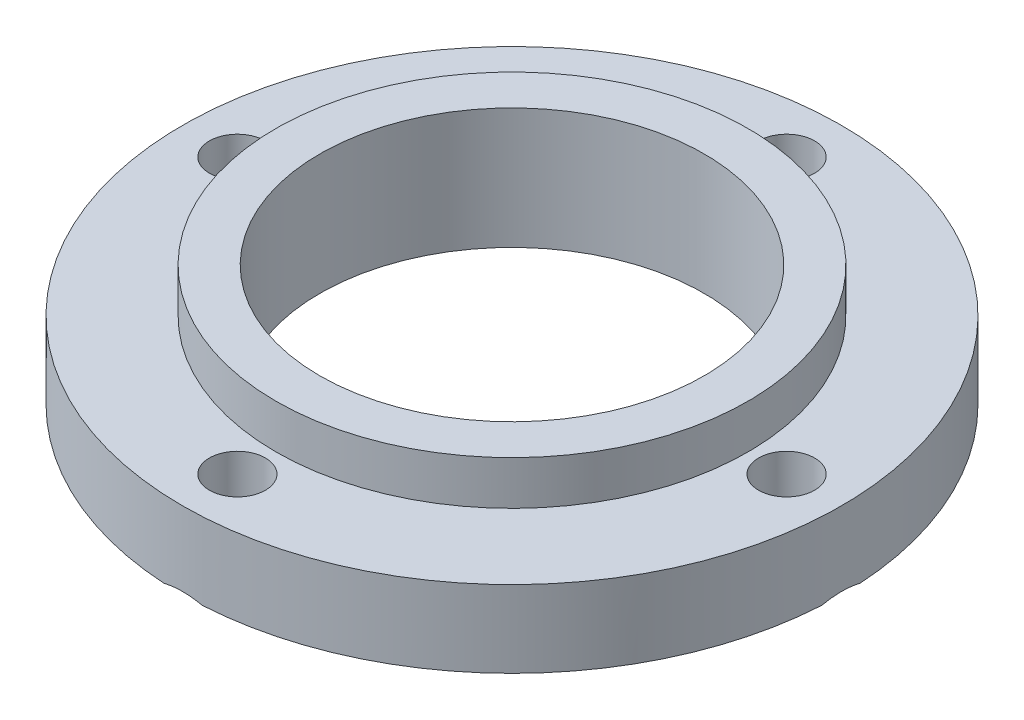
from build123d import *

# Parameters (mm, degrees)
SKETCH1_R                    = 30
SKETCH1_R_2                  = 17.5
BOSS_EXTRUDE1_DEPTH          = 7
SKETCH2_R                    = 21.5
SKETCH2_R_2                  = 17.5
BOSS_EXTRUDE2_DEPTH          = 4
SKETCH4_R                    = 2.55
CUT_EXTRUDE1_DEPTH           = 44.829214002
CHAMFER1_SIZE                = 2.7
CIRPATTERN1_COUNT            = 4
CHAMFER1_OF_CIRPATTERN1_SIZE = 2.7


with BuildPart() as part:
    # Sketch1 → Boss-Extrude1 (new body)
    with BuildSketch(Plane(origin=(0, 0, 0), x_dir=(1, 0, 0), z_dir=(0, 1, 0))):
        with Locations(Location((0, 0, 0), (0, 0, 270))):
            Circle(SKETCH1_R)
        with Locations(Location((0, 0, 0), (0, 0, 270))):
            Circle(SKETCH1_R_2, mode=Mode.SUBTRACT)
    extrude(amount=BOSS_EXTRUDE1_DEPTH)

    # Sketch2 → Boss-Extrude2 (add)
    with BuildSketch(Plane(origin=(0, 7, 0), x_dir=(1, 0, 0), z_dir=(0, 1, 0))):
        with Locations(Location((0, 0, 0), (0, 0, 270))):
            Circle(SKETCH2_R)
        with Locations(Location((0, 0, 0), (0, 0, 270))):
            Circle(SKETCH2_R_2, mode=Mode.SUBTRACT)
    extrude(amount=BOSS_EXTRUDE2_DEPTH)

    # Sketch4 → Cut-Extrude1 (cut, through all)
    with BuildSketch(Plane.XZ):
        with Locations(Location((25, 0, 0), (0, 0, 270))):
            Circle(SKETCH4_R)
    cut_extrude1 = extrude(amount=-CUT_EXTRUDE1_DEPTH, mode=Mode.SUBTRACT)

    # Chamfer1
    # the kernel refuses this chamfer: 2.7 mm, written as the material it takes off along each edge
    with BuildSketch(Plane(origin=(25, 0, 0), x_dir=(0, 0, -1), z_dir=(-1, 0, 0))) as chamfer1_piece_1:
        Polygon((2.55 + CHAMFER1_SIZE, 0), (2.55, -CHAMFER1_SIZE), (2.55, 0), align=None)
    revolve(axis=Axis((25, 0, 0), (0, -1, 0)), mode=Mode.SUBTRACT)

    # CirPattern1: Cut-Extrude1 ×4 about axis
    cirpattern1_axis = Axis((0, 0, 0), (0, 1, 0))
    for i in range(1, CIRPATTERN1_COUNT):
        add(cut_extrude1.rotate(cirpattern1_axis, i * 360 / CIRPATTERN1_COUNT), mode=Mode.SUBTRACT)

    # Chamfer1 of CirPattern1
    # the kernel refuses this chamfer: 2.7 mm, written as the material it takes off along each edge
    with BuildSketch(Plane(origin=(0, 0, -25), x_dir=(-1, 0, 0), z_dir=(0, 0, 1))) as chamfer1_of_cirpattern1_piece_1:
        Polygon((2.55 + CHAMFER1_OF_CIRPATTERN1_SIZE, 0), (2.55, -CHAMFER1_OF_CIRPATTERN1_SIZE), (2.55, 0), align=None)
    revolve(axis=Axis((0, 0, -25), (0, -1, 0)), mode=Mode.SUBTRACT)
    with BuildSketch(Plane(origin=(-25, 0, 0), x_dir=(0, 0, 1), z_dir=(1, 0, 0))) as chamfer1_of_cirpattern1_piece_2:
        Polygon((2.55 + CHAMFER1_OF_CIRPATTERN1_SIZE, 0), (2.55, -CHAMFER1_OF_CIRPATTERN1_SIZE), (2.55, 0), align=None)
    revolve(axis=Axis((-25, 0, 0), (0, -1, 0)), mode=Mode.SUBTRACT)
    with BuildSketch(Plane(origin=(0, 0, 25), x_dir=(1, 0, 0), z_dir=(0, 0, -1))) as chamfer1_of_cirpattern1_piece_3:
        Polygon((2.55 + CHAMFER1_OF_CIRPATTERN1_SIZE, 0), (2.55, -CHAMFER1_OF_CIRPATTERN1_SIZE), (2.55, 0), align=None)
    revolve(axis=Axis((0, 0, 25), (0, -1, 0)), mode=Mode.SUBTRACT)


solid = part.part
